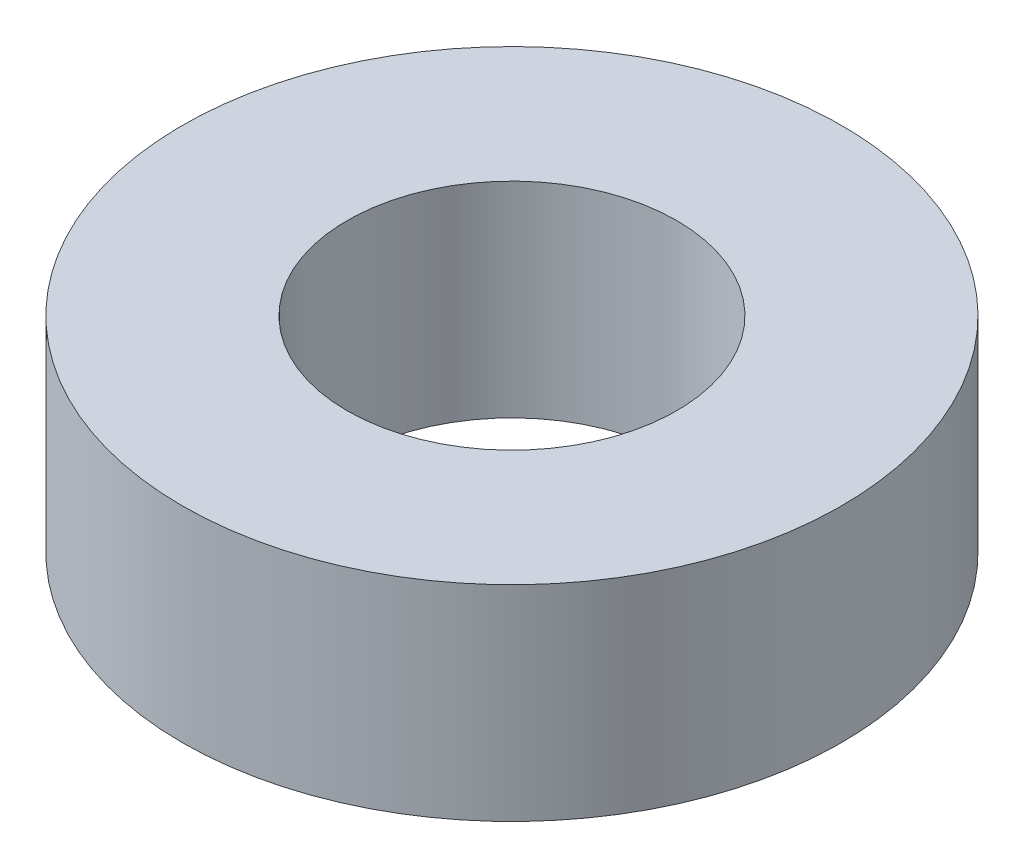
from build123d import *

# Parameters (mm, degrees)
SKETCH1_R           = 45
BOSS_EXTRUDE1_DEPTH = 28
SKETCH2_R           = 22.5
CUT_EXTRUDE1_DEPTH  = 70.526973183


with BuildPart() as part:
    # Sketch1 → Boss-Extrude1 (new body)
    with BuildSketch(Plane(origin=(0, 0, 0), x_dir=(1, 0, 0), z_dir=(0, 1, 0))):
        Circle(SKETCH1_R)
    extrude(amount=BOSS_EXTRUDE1_DEPTH)

    # Sketch2 → Cut-Extrude1 (cut, through all)
    with BuildSketch(Plane(origin=(0, 0, 0), x_dir=(1, 0, 0), z_dir=(0, 1, 0))):
        Circle(SKETCH2_R)
    extrude(amount=CUT_EXTRUDE1_DEPTH, mode=Mode.SUBTRACT)


solid = part.part
